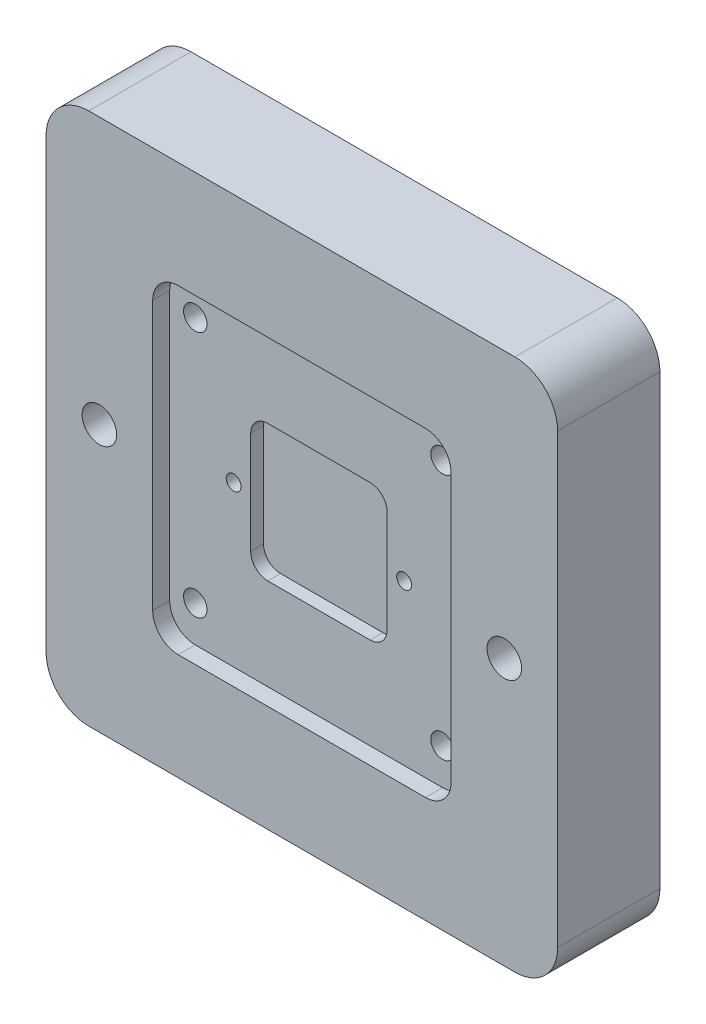
from build123d import *

# Parameters (mm, degrees)
BOSS_EXTRUDE1_DEPTH     = 4
BOSS_EXTRUDE2_DEPTH     = 20
CUT_EXTRUDE1_DEPTH      = 89.917096219
CUT_EXTRUDE1_DEPTH_BACK = 89.917096219
SKETCH8_R               = 2.75
SKETCH8_R_2             = 1.75
CUT_EXTRUDE2_START      = -7
CUT_EXTRUDE2_DEPTH      = 97.901334807
CUT_EXTRUDE3_DEPTH      = 90.901334807
CUT_EXTRUDE3_DEPTH_BACK = 20
SKETCH10_R              = 4.05
CUT_EXTRUDE4_DEPTH      = 3


with BuildPart() as part:
    # Sketch1 → Boss-Extrude1 (new body)
    with BuildSketch(Plane.XY):
        with BuildLine():
            Line((-50, 62.5), (50, 62.5))
            ThreePointArc((50, 62.5), (57.071067812, 59.571067812), (60, 52.5))
            Line((60, 52.5), (60, -52.5))
            ThreePointArc((60, -52.5), (57.071067812, -59.571067812), (50, -62.5))
            Line((50, -62.5), (-50, -62.5))
            ThreePointArc((-50, -62.5), (-57.071067812, -59.571067812), (-60, -52.5))
            Line((-60, -52.5), (-60, 52.5))
            ThreePointArc((-60, 52.5), (-57.071067812, 59.571067812), (-50, 62.5))
        make_face()
        with BuildLine():
            Line((-29, 37.5), (29, 37.5))
            ThreePointArc((29, 37.5), (33.242640687, 35.742640687), (35, 31.5))
            Line((35, 31.5), (35, -31.5))
            ThreePointArc((35, -31.5), (33.242640687, -35.742640687), (29, -37.5))
            Line((29, -37.5), (-29, -37.5))
            ThreePointArc((-29, -37.5), (-33.242640687, -35.742640687), (-35, -31.5))
            Line((-35, -31.5), (-35, 31.5))
            ThreePointArc((-35, 31.5), (-33.242640687, 35.742640687), (-29, 37.5))
        make_face(mode=Mode.SUBTRACT)
    extrude(amount=-BOSS_EXTRUDE1_DEPTH)

    # Sketch2 → Boss-Extrude2 (add)
    with BuildSketch(Plane.XY.offset(-4)):
        with BuildLine():
            Line((-50, -62.5), (50, -62.5))
            ThreePointArc((50, -62.5), (57.071067812, -59.571067812), (60, -52.5))
            Line((60, -52.5), (60, 52.5))
            ThreePointArc((60, 52.5), (57.071067812, 59.571067812), (50, 62.5))
            Line((50, 62.5), (-50, 62.5))
            ThreePointArc((-50, 62.5), (-57.071067812, 59.571067812), (-60, 52.5))
            Line((-60, 52.5), (-60, -52.5))
            ThreePointArc((-60, -52.5), (-57.071067812, -59.571067812), (-50, -62.5))
        make_face()
    extrude(amount=-BOSS_EXTRUDE2_DEPTH)

    # Sketch8 → Cut-Extrude1 (cut, two sides: drawn at the far end of the back side and taken through both)
    with BuildSketch(Plane.XY.offset(-4).offset(-CUT_EXTRUDE1_DEPTH_BACK)):
        with Locations((-29, 29)):
            Circle(SKETCH8_R)
        with Locations((29, 29)):
            Circle(SKETCH8_R)
        with Locations((29, -29)):
            Circle(SKETCH8_R)
        with Locations((-29, -29)):
            Circle(SKETCH8_R)
        with Locations((-20, 0)):
            Circle(SKETCH8_R_2)
        with Locations((20, 0)):
            Circle(SKETCH8_R_2)
    extrude(amount=CUT_EXTRUDE1_DEPTH + CUT_EXTRUDE1_DEPTH_BACK, mode=Mode.SUBTRACT)

    # Sketch9 → Cut-Extrude2 (cut)
    with BuildSketch(Plane(origin=(0, 0, -24), x_dir=(-1, 0, 0), z_dir=(0, 0, -1)).offset(CUT_EXTRUDE2_START)):
        Polygon((-33.1, 26.632863896), (-29, 24.265727793), (-24.9, 26.632863896), (-24.9, 31.367136104), (-29, 33.734272207), (-33.1, 31.367136104), align=None)
    cut_extrude2 = extrude(amount=CUT_EXTRUDE2_DEPTH, mode=Mode.SUBTRACT)

    # Sketch-Pattern1: Cut-Extrude2 at 5 more places
    with Locations((-58, 0, 0), (0, -58, 0), (-58, -58, 0), (-49, -29, 0), (-9, -29, 0)):
        add(cut_extrude2, mode=Mode.SUBTRACT)

    # Sketch10 → Cut-Extrude3 (cut, two sides: drawn at the far end of the back side and taken through both)
    with BuildSketch(Plane.XY.offset(-CUT_EXTRUDE3_DEPTH_BACK)):
        with Locations((47.5, 0)):
            Circle(SKETCH10_R)
        with Locations((-47.5, 0)):
            Circle(SKETCH10_R)
    extrude(amount=CUT_EXTRUDE3_DEPTH + CUT_EXTRUDE3_DEPTH_BACK, mode=Mode.SUBTRACT)

    # Sketch11 → Cut-Extrude4 (cut)
    with BuildSketch(Plane.XY.offset(-4)):
        with BuildLine():
            Line((-12, 16), (12, 16))
            ThreePointArc((12, 16), (14.828427125, 14.828427125), (16, 12))
            Line((16, 12), (16, -12))
            ThreePointArc((16, -12), (14.828427125, -14.828427125), (12, -16))
            Line((12, -16), (-12, -16))
            ThreePointArc((-12, -16), (-14.828427125, -14.828427125), (-16, -12))
            Line((-16, -12), (-16, 12))
            ThreePointArc((-16, 12), (-14.828427125, 14.828427125), (-12, 16))
        make_face()
    extrude(amount=-CUT_EXTRUDE4_DEPTH, mode=Mode.SUBTRACT)


solid = part.part
